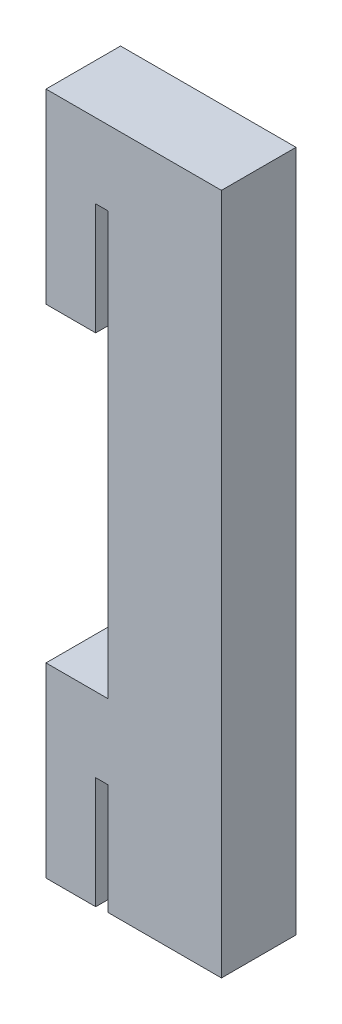
from build123d import *

# Parameters (mm, degrees)
BOSS_EXTRU_1_DEPTH = 6


with BuildPart() as part:
    # Esquisse1 → Boss.-Extru.1 (new body)
    with BuildSketch(Plane.XY):
        Polygon((0, 0), (0, 9), (1, 9), (1, 0.09638948), (10.121873618, 0.09638948), (10.121873618, 55), (-4, 55), (-4, 40), (0, 40), (0, 49), (1, 49), (1, 15), (-4, 15), (-4, 0), align=None)
    extrude(amount=BOSS_EXTRU_1_DEPTH)


solid = part.part
